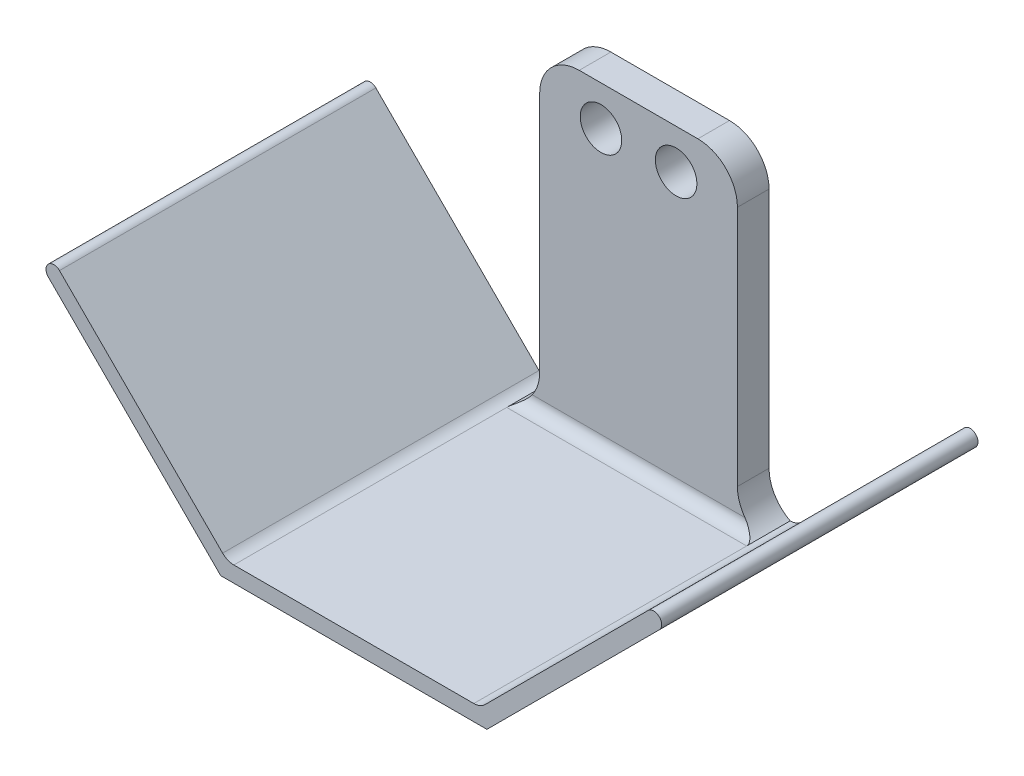
from build123d import *

# Parameters (mm, degrees)
BOSS_EXTRUDE2_DEPTH = 40
FILLET1_R           = 4
SKETCH3_W           = 50
SKETCH3_H           = 8
BOSS_EXTRUDE3_DEPTH = 80
SKETCH5_R           = 5.25
CUT_EXTRUDE1_DEPTH  = 133.827565624
FILLET2_R           = 10
FILLET3_R           = 3


with BuildPart() as part:
    # Sketch2 → Boss-Extrude2 (new, symmetric)
    with BuildSketch(Plane.XY):
        with BuildLine():
            Line((-32, 0), (32, 0))
            Line((32, 0), (74.426406871, 42.426406871))
            ThreePointArc((74.426406871, 42.426406871), (77.254833996, 42.426406871), (77.254833996, 39.597979746))
            Line((77.254833996, 39.597979746), (33.656854249, -4))
            Line((33.656854249, -4), (-33.656854249, -4))
            Line((-33.656854249, -4), (-77.254833996, 39.597979746))
            ThreePointArc((-77.254833996, 39.597979746), (-77.254833996, 42.426406871), (-74.426406871, 42.426406871))
            Line((-74.426406871, 42.426406871), (-32, 0))
        make_face()
    extrude(amount=BOSS_EXTRUDE2_DEPTH, both=True)

    # Fillet1
    fillet1_edges = [part.edges().sort_by_distance(p)[0] for p in [
        (-32, 0, 0),
        (32, 0, 0),
    ]]
    fillet(fillet1_edges, radius=FILLET1_R)

    # Sketch3 → Boss-Extrude3 (add)
    with BuildSketch(Plane(origin=(0, 0, 0), x_dir=(1, 0, 0), z_dir=(0, 1, 0))):
        with Locations((0, 36)):
            Rectangle(SKETCH3_W, SKETCH3_H)
    extrude(amount=BOSS_EXTRUDE3_DEPTH)

    # Sketch5 → Cut-Extrude1 (cut, through all)
    with BuildSketch(Plane.XY.offset(-32)):
        with Locations((-9.5, 70)):
            Circle(SKETCH5_R)
        with Locations((9.5, 70)):
            Circle(SKETCH5_R)
    extrude(amount=-CUT_EXTRUDE1_DEPTH, mode=Mode.SUBTRACT)

    # Fillet2
    # the kernel refuses this fillet: 10 mm, written as the material it adds along each edge
    with BuildSketch(Plane(origin=(25, 0, -40), x_dir=(1, 0, 0), z_dir=(0, 0, 1)), Plane(origin=(-25, 0, -32), x_dir=(-1, 0, 0), z_dir=(0, 0, -1))) as fillet2_piece_1:
        with BuildLine():
            CenterArc((10, 8.849503291), FILLET2_R, 180, 62.245409403)
            Line((0, 8.849503291), (0, 0))
            Line((0, 0), (5.343145751, 0))
        make_face()
    extrude(amount=8)
    # the kernel refuses this fillet: 10 mm, written as the material it takes off along each edge
    with BuildSketch(Plane(origin=(25, 80, -65), x_dir=(-1, 0, 0), z_dir=(0, 0, 1))) as fillet2_2_piece_1:
        with BuildLine():
            CenterArc((FILLET2_R, FILLET2_R), FILLET2_R, 180, 90)
            Line((0, FILLET2_R), (0, 0))
            Line((0, 0), (FILLET2_R, 0))
        make_face()
    extrude(amount=58, mode=Mode.SUBTRACT)
    with BuildSketch(Plane(origin=(-25, 80, -7), x_dir=(0, -1, 0), z_dir=(0, 0, -1))) as fillet2_2_piece_2:
        with BuildLine():
            CenterArc((FILLET2_R, -FILLET2_R), FILLET2_R, 90, 90)
            Line((0, -FILLET2_R), (0, 0))
            Line((0, 0), (FILLET2_R, 0))
        make_face()
    extrude(amount=58, mode=Mode.SUBTRACT)

    # Fillet3
    # the kernel refuses this fillet: 3 mm, written as the material it adds along each edge
    with BuildSketch(Plane(origin=(-37.843145751, 0, -32), x_dir=(0, 1, 0), z_dir=(1, 0, 0))) as fillet3_piece_1_section:
        with BuildLine():
            CenterArc((FILLET3_R, FILLET3_R), FILLET3_R, 180, 90)
            Line((0, FILLET3_R), (0, 0))
            Line((0, 0), (FILLET3_R, 0))
        make_face()
    fillet3_piece_1 = extrude(amount=75.686291501, mode=Mode.PRIVATE)
    fillet3_piece_1 = fillet3_piece_1 - Plane(origin=(35, 8.849503291, -32), x_dir=(1, 0, 0), z_dir=(0, 0, -1)) * Cylinder(10, 164, mode=Mode.PRIVATE)
    fillet3_piece_1 = fillet3_piece_1 - Plane(origin=(-35, 8.849503291, -32), x_dir=(-1, 0, 0), z_dir=(0, 0, 1)) * Cylinder(10, 164, mode=Mode.PRIVATE)
    add(fillet3_piece_1)


solid = part.part
